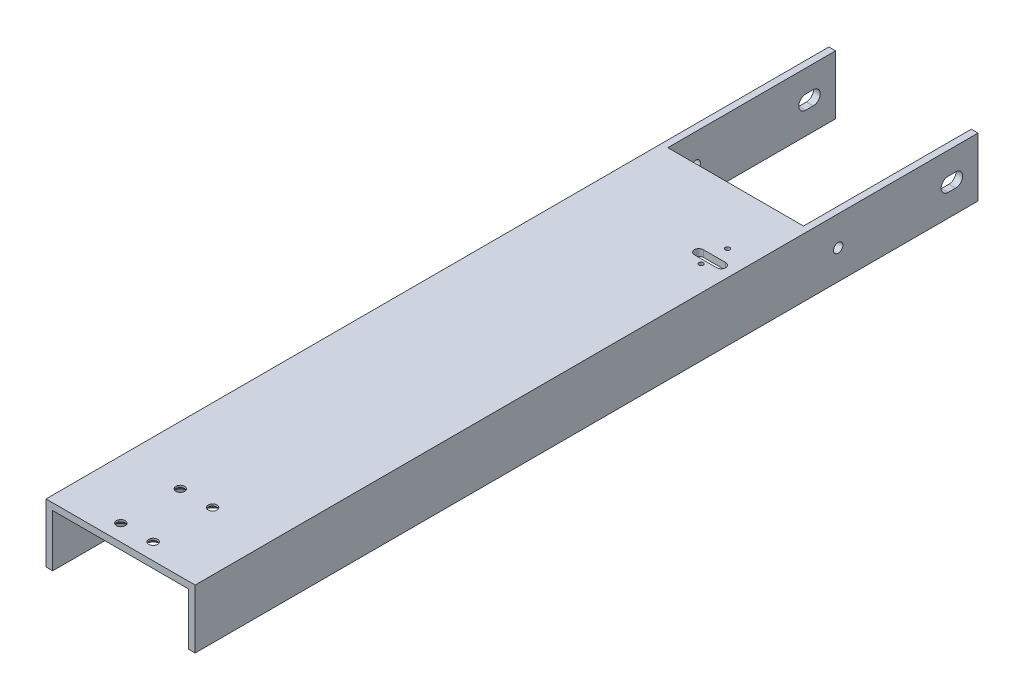
from build123d import *

# Parameters (mm, degrees)
BOSS_EXTRUDE1_DEPTH = 533.4
SKETCH3_R           = 1.524
SKETCH3_R_2         = 3
SKETCH3_W           = 92.456
SKETCH3_H           = 114.3
CUT_EXTRUDE1_DEPTH  = 538.314412075
SKETCH4_R           = 3.175
CUT_EXTRUDE2_DEPTH  = 545.47102533
CHAMFER1_SIZE       = 3.25


with BuildPart() as part:
    # Sketch1 → Boss-Extrude1 (new body)
    with BuildSketch(Plane.XY):
        Polygon((-50.8, 0), (50.8, 0), (50.8, -40.132), (46.228, -40.132), (46.228, -4.572), (-46.228, -4.572), (-46.228, -40.132), (-50.8, -40.132), align=None)
    extrude(amount=BOSS_EXTRUDE1_DEPTH)

    # Sketch3 → Cut-Extrude1 (cut, through all)
    with BuildSketch(Plane(origin=(0, 0, 0), x_dir=(1, 0, 0), z_dir=(0, 1, 0))):
        with Locations((33.655, -153.495590235)):
            Circle(SKETCH3_R)
        with Locations((33.655, -171.529590235)):
            Circle(SKETCH3_R)
        with Locations((-11.0109, -522.1859)):
            Circle(SKETCH3_R_2)
        with Locations((11.0109, -481.6729)):
            Circle(SKETCH3_R_2)
        with Locations((-11.0109, -481.6729)):
            Circle(SKETCH3_R_2)
        with Locations((11.0109, -522.1859)):
            Circle(SKETCH3_R_2)
        with Locations((0, -57.15)):
            Rectangle(SKETCH3_W, SKETCH3_H)
        with BuildLine():
            Line((26.035, -162.385590235), (41.275, -162.385590235))
            ThreePointArc((41.275, -162.385590235), (44.323, -165.433590235), (41.275, -168.481590235))
            Line((41.275, -168.481590235), (26.035, -168.481590235))
            ThreePointArc((26.035, -168.481590235), (22.987, -165.433590235), (26.035, -162.385590235))
        make_face()
    extrude(amount=-CUT_EXTRUDE1_DEPTH, mode=Mode.SUBTRACT)

    # Sketch4 → Cut-Extrude2 (cut, through all)
    with BuildSketch(Plane(origin=(50.8, 0, 0), x_dir=(0, 0, -1), z_dir=(1, 0, 0))):
        with Locations((-95.25, -20.066)):
            Circle(SKETCH4_R)
        with BuildLine():
            Line((-15.24, -24.8285), (-20.32, -24.8285))
            ThreePointArc((-20.32, -24.8285), (-25.0825, -20.066), (-20.32, -15.3035))
            Line((-20.32, -15.3035), (-15.24, -15.3035))
            ThreePointArc((-15.24, -15.3035), (-10.4775, -20.066), (-15.24, -24.8285))
        make_face()
    extrude(amount=-CUT_EXTRUDE2_DEPTH, mode=Mode.SUBTRACT)

    # Chamfer1
    chamfer1_edges = [part.edges().sort_by_distance(p)[0] for p in [
        (8.0109, -4.572, 481.6729),
        (8.0109, -4.572, 522.1859),
        (-14.0109, -4.572, 522.1859),
        (-14.0109, -4.572, 481.6729),
    ]]
    chamfer(chamfer1_edges, length=CHAMFER1_SIZE)


solid = part.part
